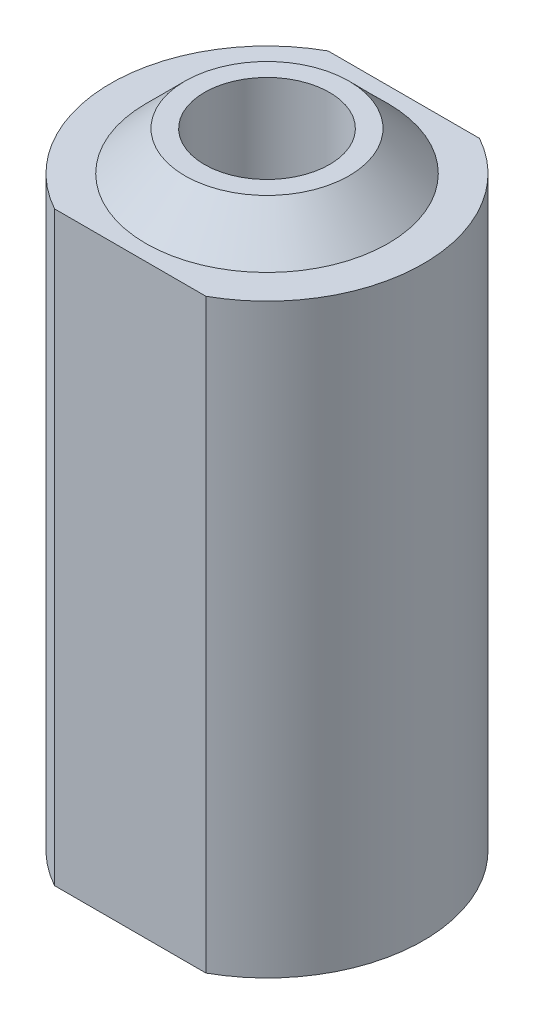
from build123d import *

# Parameters (mm, degrees)
SKETCH1_R           = 1.6
BOSS_EXTRUDE1_DEPTH = 15
SKETCH2_R           = 3.1
SKETCH2_R_2         = 1.6
BOSS_EXTRUDE2_DEPTH = 1
CHAMFER1_SIZE       = 1


with BuildPart() as part:
    # Sketch1 → Boss-Extrude1 (new body)
    with BuildSketch(Plane(origin=(0, 0, 0), x_dir=(1, 0, 0), z_dir=(0, 1, 0))):
        with BuildLine():
            Line((-1.936491673, -3.5), (1.936491673, -3.5))
            ThreePointArc((1.936491673, -3.5), (4, 0), (1.936491673, 3.5))
            Line((1.936491673, 3.5), (-1.936491673, 3.5))
            ThreePointArc((-1.936491673, 3.5), (-4, 0), (-1.936491673, -3.5))
        make_face()
        with Locations(Location((0, 0, 0), (0, 0, 270))):
            Circle(SKETCH1_R, mode=Mode.SUBTRACT)
    extrude(amount=BOSS_EXTRUDE1_DEPTH)

    # Sketch2 → Boss-Extrude2 (add)
    with BuildSketch(Plane(origin=(0, 15, 0), x_dir=(1, 0, 0), z_dir=(0, 1, 0))):
        with Locations(Location((0, 0, 0), (0, 0, 270))):
            Circle(SKETCH2_R)
        with Locations(Location((0, 0, 0), (0, 0, 270))):
            Circle(SKETCH2_R_2, mode=Mode.SUBTRACT)
    extrude(amount=BOSS_EXTRUDE2_DEPTH)

    # Chamfer1
    chamfer1_edges = [part.edges().sort_by_distance(p)[0] for p in [
        (0, 16, -3.1),
    ]]
    chamfer(chamfer1_edges, length=CHAMFER1_SIZE - 0.0001)  # a hair under: the kernel refuses the full size


solid = part.part
